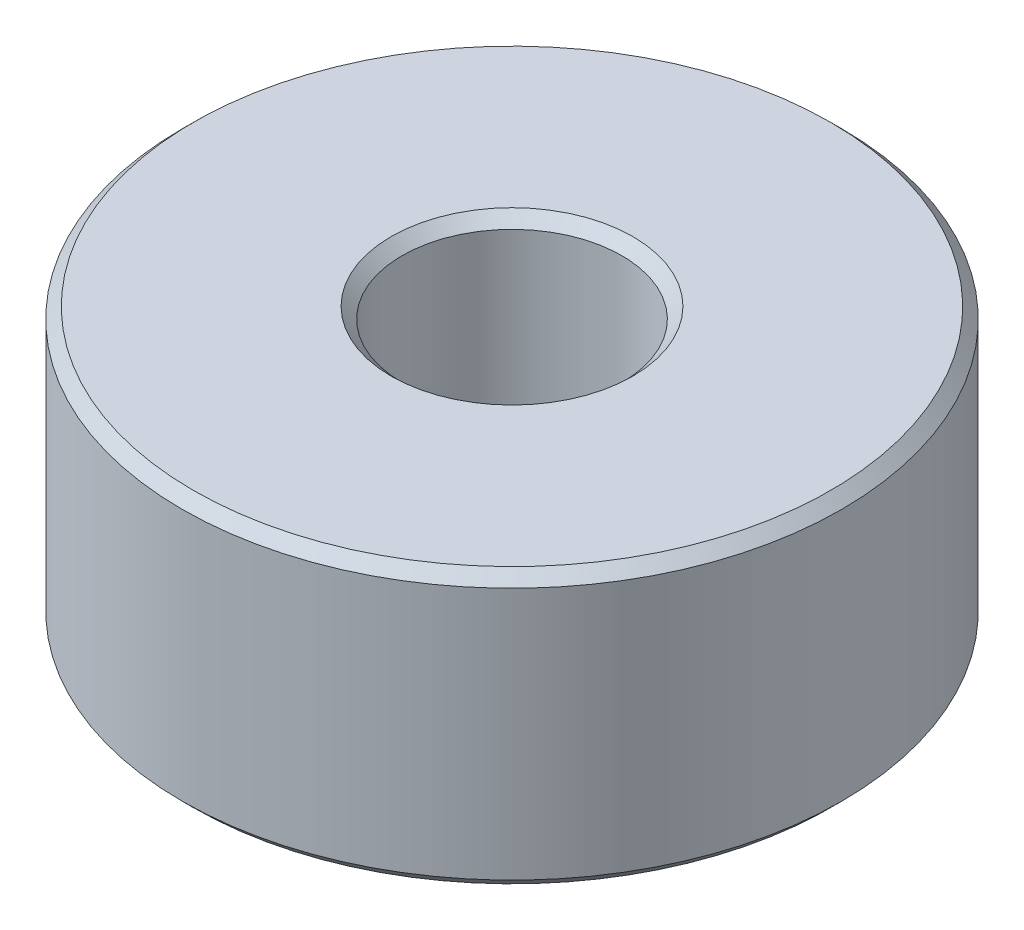
from build123d import *

# Parameters (mm, degrees)
SKETCH1_R           = 3
BOSS_EXTRUDE1_DEPTH = 2.5
SKETCH2_R           = 1
CUT_EXTRUDE1_DEPTH  = 5.5
CHAMFER1_SIZE       = 0.1


with BuildPart() as part:
    # Sketch1 → Boss-Extrude1 (new body)
    with BuildSketch(Plane(origin=(0, 0, 0), x_dir=(1, 0, 0), z_dir=(0, 1, 0))):
        Circle(SKETCH1_R)
    extrude(amount=BOSS_EXTRUDE1_DEPTH)

    # Sketch2 → Cut-Extrude1 (cut)
    with BuildSketch(Plane(origin=(0, 2.5, 0), x_dir=(1, 0, 0), z_dir=(0, 1, 0))):
        Circle(SKETCH2_R)
    extrude(amount=-CUT_EXTRUDE1_DEPTH, mode=Mode.SUBTRACT)

    # Chamfer1
    chamfer1_edges = [part.edges().sort_by_distance(p)[0] for p in [
        (-3, 0, 0),
        (-3, 2.5, 0),
        (-1, 2.5, 0),
    ]]
    chamfer(chamfer1_edges, length=CHAMFER1_SIZE)


solid = part.part
